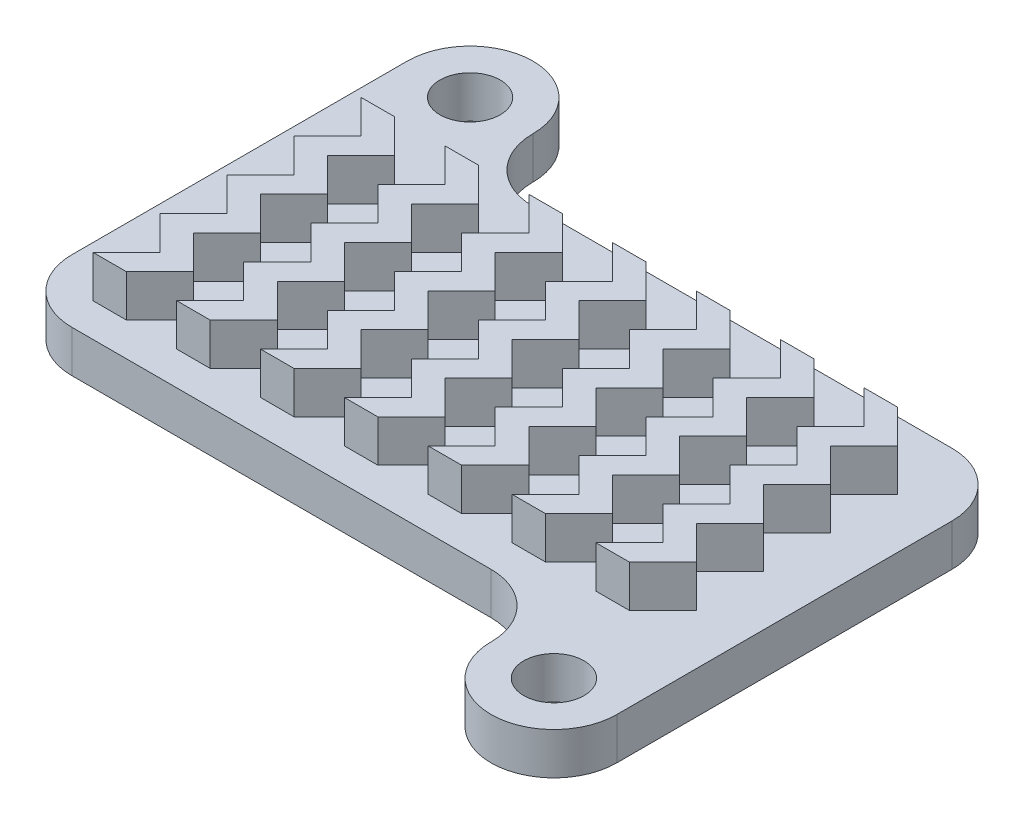
from build123d import *

# Parameters (mm, degrees)
BOSS_EXTRUDE1_DEPTH = 3.175
SKETCH2_R           = 2.286
CUT_EXTRUDE1_DEPTH  = 34.89972345
FILLET1_START       = -1
FILLET1_DEPTH       = 5
FILLET1_2_DEPTH     = 3.175
BOSS_EXTRUDE2_DEPTH = 3.175
LPATTERN1_COUNT     = 4
LPATTERN1_PITCH     = 6.35
LPATTERN1_COL_COUNT = 4
LPATTERN1_COL_PITCH = 6.35


with BuildPart() as part:
    # Sketch1 → Boss-Extrude1 (new body)
    with BuildSketch(Plane(origin=(0, 0, 0), x_dir=(1, 0, 0), z_dir=(0, 1, 0))):
        with BuildLine():
            Line((-15.875, 12.7), (-15.875, 17.4625))
            ThreePointArc((-15.875, 17.4625), (-20.6375, 22.225), (-25.4, 17.4625))
            Line((-25.4, 17.4625), (-25.4, -12.7))
            Line((-25.4, -12.7), (15.875, -12.7))
            Line((15.875, -12.7), (15.875, -17.4625))
            ThreePointArc((15.875, -17.4625), (20.6375, -22.225), (25.4, -17.4625))
            Line((25.4, -17.4625), (25.4, 12.7))
            Line((25.4, 12.7), (-15.875, 12.7))
        make_face()
    extrude(amount=BOSS_EXTRUDE1_DEPTH)

    # Sketch2 → Cut-Extrude1 (cut, through all)
    with BuildSketch(Plane(origin=(0, 3.175, 0), x_dir=(1, 0, 0), z_dir=(0, 1, 0))):
        with Locations(Location((-20.6375, 17.4625, 0), (0, 0, 270))):
            Circle(SKETCH2_R)
        with Locations(Location((20.6375, -17.4625, 0), (0, 0, 270))):
            Circle(SKETCH2_R)
    extrude(amount=-CUT_EXTRUDE1_DEPTH, mode=Mode.SUBTRACT)

    # Fillet1: read off the stored shape, not the designer's step
    # Fillet1 outline → Fillet1 (cut)
    with BuildSketch(Plane(origin=(0, 0, 0), x_dir=(1, 0, 0), z_dir=(0, 1, 0)).offset(FILLET1_START)):
        with BuildLine():
            Line((25.4, 12.7), (20.6375, 12.7))
            ThreePointArc((20.6375, 12.7), (24.005096045, 11.305096045), (25.4, 7.9375))
            Line((25.4, 7.9375), (25.4, 12.7))
        make_face()
        with BuildLine():
            Line((-25.4, -12.7), (-20.6375, -12.7))
            ThreePointArc((-20.6375, -12.7), (-24.005096045, -11.305096045), (-25.4, -7.9375))
            Line((-25.4, -7.9375), (-25.4, -12.7))
        make_face()
    extrude(amount=FILLET1_DEPTH, mode=Mode.SUBTRACT)

    # Fillet1 2 outline → Fillet1 2 (add)
    with BuildSketch(Plane(origin=(0, 0, 0), x_dir=(1, 0, 0), z_dir=(0, 1, 0))):
        with BuildLine():
            Line((-15.875, 12.7), (-11.1125, 12.7))
            ThreePointArc((-11.1125, 12.7), (-14.480096045, 14.094903955), (-15.875, 17.4625))
            Line((-15.875, 17.4625), (-15.875, 12.7))
        make_face()
        with BuildLine():
            Line((15.875, -12.7), (11.1125, -12.7))
            ThreePointArc((11.1125, -12.7), (14.480096045, -14.094903955), (15.875, -17.4625))
            Line((15.875, -17.4625), (15.875, -12.7))
        make_face()
    extrude(amount=FILLET1_2_DEPTH)

    # Sketch3 → Boss-Extrude2 (add)
    with BuildSketch(Plane(origin=(0, 3.175, 0), x_dir=(1, 0, 0), z_dir=(0, 1, 0))):
        Polygon((0, 10.16), (2.54, 7.62), (0, 5.08), (2.54, 2.54), (0, 0), (2.54, -2.54), (0, -5.08), (2.54, -7.62), (0, -10.16), (-2.54, -10.16), (0, -7.62), (-2.54, -5.08), (0, -2.54), (-2.54, 0), (0, 2.54), (-2.54, 5.08), (0, 7.62), (-2.54, 10.16), align=None)
    boss_extrude2 = extrude(amount=BOSS_EXTRUDE2_DEPTH)

    # LPattern1: Boss-Extrude2 ×4
    with Locations(*[(-i * LPATTERN1_PITCH, 0, 0) for i in range(1, LPATTERN1_COUNT)]):
        add(boss_extrude2)

    # LPattern1 col: Boss-Extrude2 ×4
    with Locations(*[(i * LPATTERN1_COL_PITCH, 0, 0) for i in range(1, LPATTERN1_COL_COUNT)]):
        add(boss_extrude2)


solid = part.part
